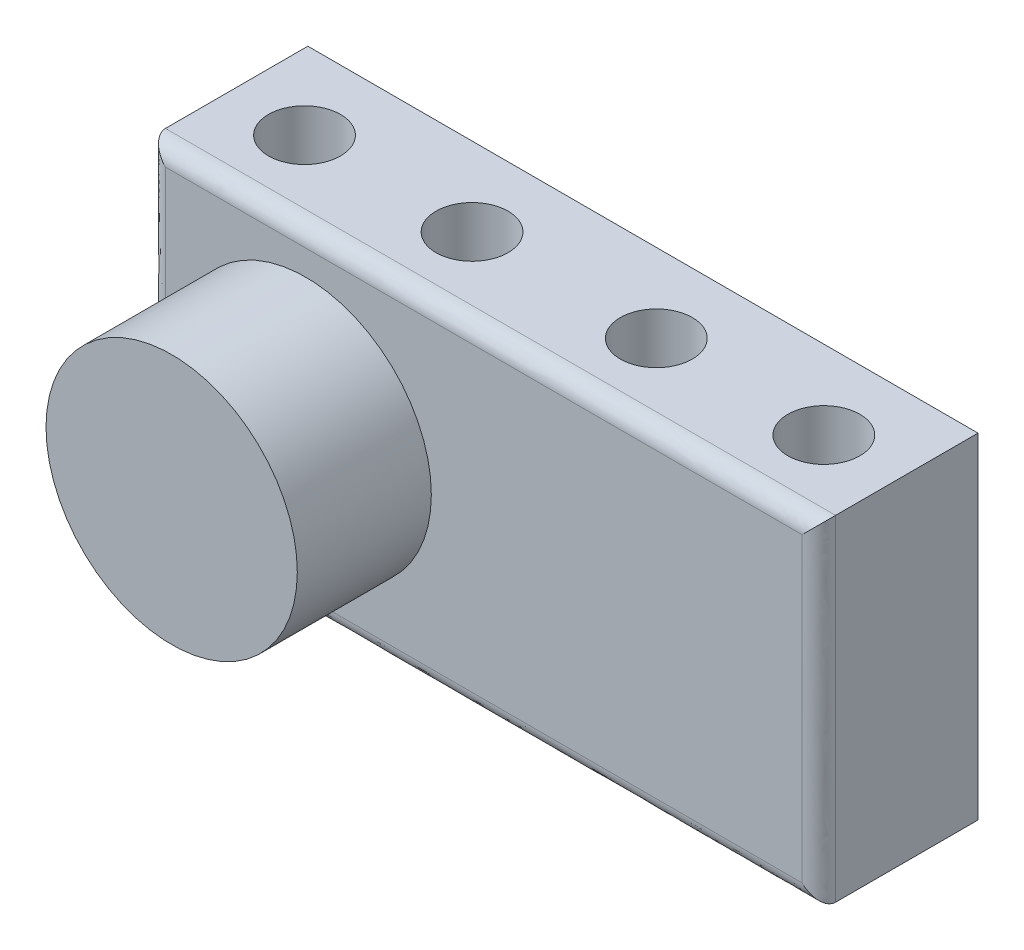
from build123d import *

# Parameters (mm, degrees)
SKETCH1_W           = 40
SKETCH1_H           = 20
BOSS_EXTRUDE1_DEPTH = 9.5
FILLET1_R           = 1
SKETCH4_R           = 7.5
BOSS_EXTRUDE2_DEPTH = 8
SKETCH5_R           = 2.15
CUT_EXTRUDE1_DEPTH  = 34.260336739


with BuildPart() as part:
    # Sketch1 → Boss-Extrude1 (new body)
    with BuildSketch(Plane.XY):
        Rectangle(SKETCH1_W, SKETCH1_H)
    extrude(amount=BOSS_EXTRUDE1_DEPTH)

    # Fillet1
    fillet1_edges = [part.edges().sort_by_distance(p)[0] for p in [
        (0, -10, 9.5),
        (20, 0, 9.5),
        (0, 10, 9.5),
        (-20, 0, 9.5),
    ]]
    fillet(fillet1_edges, radius=FILLET1_R)

    # Sketch4 → Boss-Extrude2 (add)
    with BuildSketch(Plane.XY.offset(9.5)):
        with Locations((-10.628602575, 0)):
            Circle(SKETCH4_R)
    extrude(amount=BOSS_EXTRUDE2_DEPTH)

    # Sketch5 → Cut-Extrude1 (cut, through all)
    with BuildSketch(Plane.XZ.offset(10)):
        with Locations((-15.5, 4.7)):
            Circle(SKETCH5_R)
        with Locations((-5.5, 4.7)):
            Circle(SKETCH5_R)
        with Locations((5.5, 4.7)):
            Circle(SKETCH5_R)
        with Locations((15.5, 4.7)):
            Circle(SKETCH5_R)
    extrude(amount=-CUT_EXTRUDE1_DEPTH, mode=Mode.SUBTRACT)


solid = part.part
